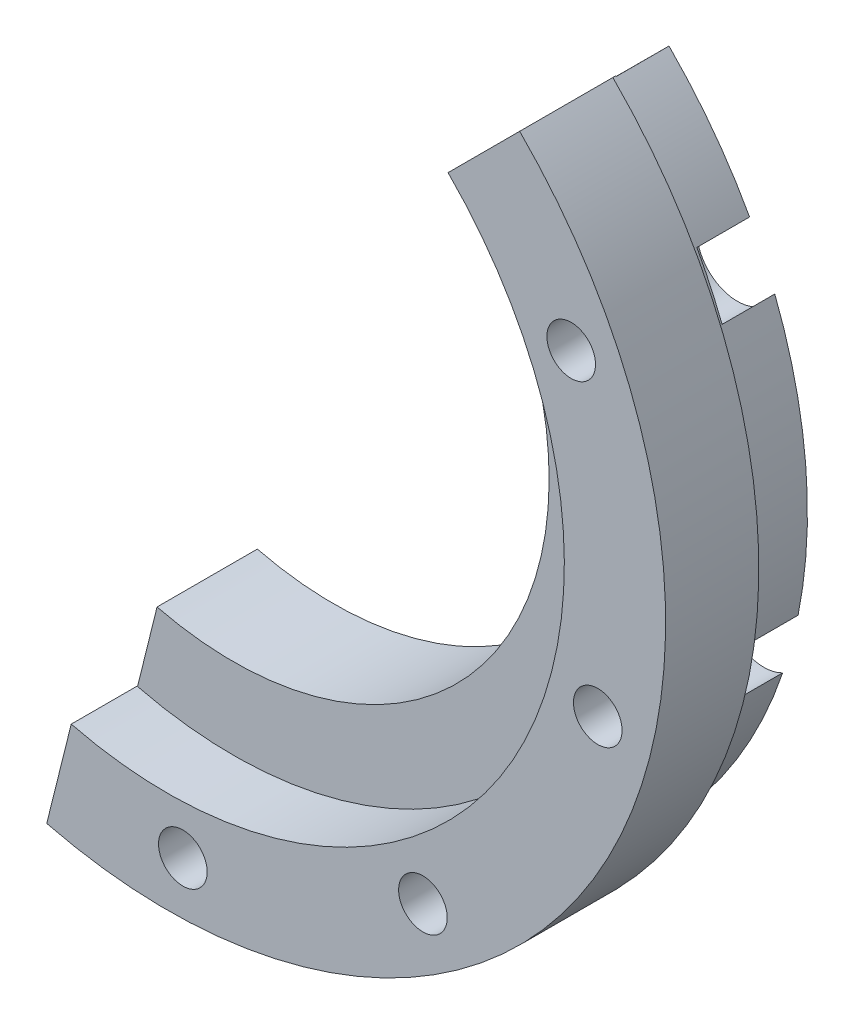
from build123d import *

# Parameters (mm, degrees)
BOSS_1_DEPTH  = 5.6
BOSS_2_DEPTH  = 4.95
CUT_3_DEPTH   = 1.1
S_HOLE4_R     = 1.2
HOLE_4_DEPTH  = 8.4
S_HOLE5_R     = 2
HOLE_5_DEPTH  = 2.7
S_HOLE6_R     = 1.2
HOLE_6_DEPTH  = 8.4
S_HOLE7_R     = 2
HOLE_7_DEPTH  = 2.7
S_HOLE8_R     = 1.2
HOLE_8_DEPTH  = 8.4
S_HOLE9_R     = 2
HOLE_9_DEPTH  = 2.7
S_HOLE10_R    = 1.2
HOLE_10_DEPTH = 8.4
S_HOLE11_R    = 2
HOLE_11_DEPTH = 2.7


with BuildPart() as part:
    # S_prism1 → Boss_1 (new body)
    with BuildSketch(Plane.XY.offset(24.6)):
        with BuildLine():
            Line((-5.951278632, -23.869274866), (-4.741669154, -19.017796235))
            ThreePointArc((-4.741669154, -19.017796235), (17.05897164, -9.651501778), (13.859292911, 13.859292911))
            Line((13.859292911, 13.859292911), (17.394826817, 17.394826817))
            ThreePointArc((17.394826817, 17.394826817), (21.41075012, -12.113619579), (-5.951278632, -23.869274866))
        make_face()
    extrude(amount=BOSS_1_DEPTH)

    # S_prism2 → Boss_2 (add)
    with BuildSketch(Plane.XY.offset(22)):
        with BuildLine():
            Line((-5.633228846, -22.711819231), (-3.755485898, -15.14121282))
            ThreePointArc((-3.755485898, -15.14121282), (13.577548857, -7.681807538), (11.044334296, 11.017380812))
            Line((11.044334296, 11.017380812), (16.566501443, 16.526071219))
            ThreePointArc((16.566501443, 16.526071219), (20.366323285, -11.522711306), (-5.633228846, -22.711819231))
        make_face()
    extrude(amount=BOSS_2_DEPTH)

    # S_pcut3 → Cut_3 (cut)
    with BuildSketch(Plane.XY.offset(24.5)):
        with BuildLine():
            Line((-6.418712319, -23.954960492), (-6.056365655, -22.602664335))
            ThreePointArc((-6.056365655, -22.602664335), (20.366323285, -11.522711306), (16.255005869, 16.832551328))
            Line((16.255005869, 16.832551328), (17.227527587, 17.839627048))
            ThreePointArc((17.227527587, 17.839627048), (21.584821259, -12.212104291), (-6.418712319, -23.954960492))
        make_face()
    extrude(amount=CUT_3_DEPTH, mode=Mode.SUBTRACT)

    # S_hole4 → Hole_4 (cut)
    with BuildSketch(Plane.XY.offset(21.9)):
        with Locations((19.938771315, 9.297601758)):
            Circle(S_HOLE4_R)
    extrude(amount=HOLE_4_DEPTH, mode=Mode.SUBTRACT)

    # S_hole5 → Hole_5 (cut)
    with BuildSketch(Plane.XY.offset(21.9)):
        with Locations((19.938771315, 9.297601758)):
            Circle(S_HOLE5_R)
    extrude(amount=HOLE_5_DEPTH, mode=Mode.SUBTRACT)

    # S_hole6 → Hole_6 (cut)
    with BuildSketch(Plane.XY.offset(21.9)):
        with Locations((21.250368178, -5.694018992)):
            Circle(S_HOLE6_R)
    extrude(amount=HOLE_6_DEPTH, mode=Mode.SUBTRACT)

    # S_hole7 → Hole_7 (cut)
    with BuildSketch(Plane.XY.offset(21.9)):
        with Locations((21.250368178, -5.694018992)):
            Circle(S_HOLE7_R)
    extrude(amount=HOLE_7_DEPTH, mode=Mode.SUBTRACT)

    # S_hole8 → Hole_8 (cut)
    with BuildSketch(Plane.XY.offset(21.9)):
        with Locations((12.6186816, -18.021344974)):
            Circle(S_HOLE8_R)
    extrude(amount=HOLE_8_DEPTH, mode=Mode.SUBTRACT)

    # S_hole9 → Hole_9 (cut)
    with BuildSketch(Plane.XY.offset(21.9)):
        with Locations((12.6186816, -18.021344974)):
            Circle(S_HOLE9_R)
    extrude(amount=HOLE_9_DEPTH, mode=Mode.SUBTRACT)

    # S_hole10 → Hole_10 (cut)
    with BuildSketch(Plane.XY.offset(21.9)):
        with Locations((0.767788927, -21.986598194)):
            Circle(S_HOLE10_R)
    extrude(amount=HOLE_10_DEPTH, mode=Mode.SUBTRACT)

    # S_hole11 → Hole_11 (cut)
    with BuildSketch(Plane.XY.offset(21.9)):
        with Locations((0.767788927, -21.986598194)):
            Circle(S_HOLE11_R)
    extrude(amount=HOLE_11_DEPTH, mode=Mode.SUBTRACT)


solid = part.part
